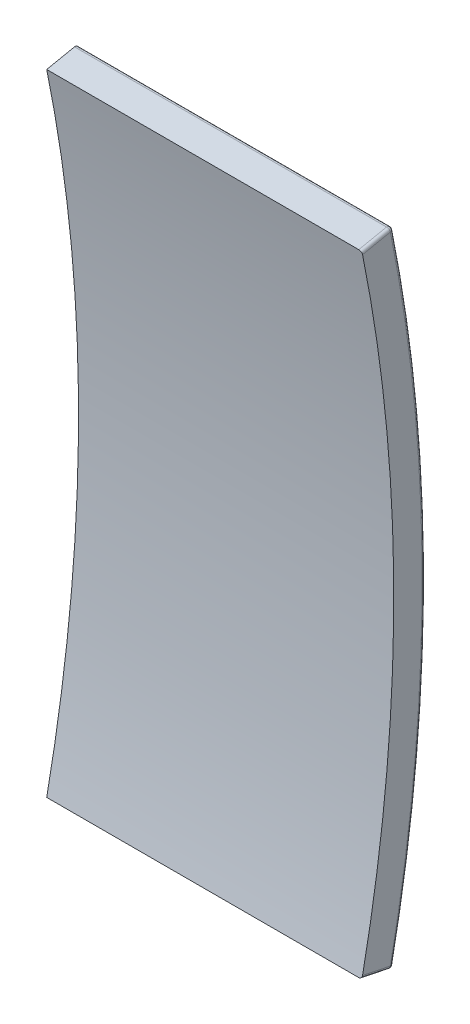
from build123d import *

# Parameters (mm, degrees)
BOSS_EXTRUDE1_DEPTH = 10
FILLET3_R           = 0.1


with BuildPart() as part:
    # airflap → Boss-Extrude1 (new body)
    with BuildSketch(Plane(origin=(0, 0, 0), x_dir=(0, 0, -1), z_dir=(1, 0, 0))):
        with BuildLine():
            Line((49.969590753, 10.2), (48.989794856, 10))
            ThreePointArc((48.989794856, 10), (50, 0), (48.989794856, -10))
            Line((48.989794856, -10), (49.969590753, -10.2))
            ThreePointArc((49.969590753, -10.2), (51, 0), (49.969590753, 10.2))
        make_face()
    extrude(amount=BOSS_EXTRUDE1_DEPTH)

    # Fillet3
    fillet3_edges = [part.edges().sort_by_distance(p)[0] for p in [
        (10, 10.1, -49.479692804),
        (10, -10.1, -49.479692804),
        (5, -10.2, -49.969590753),
        (5, 10.2, -49.969590753),
        (10, 0, -51),
    ]]
    fillet(fillet3_edges, radius=FILLET3_R)


solid = part.part
